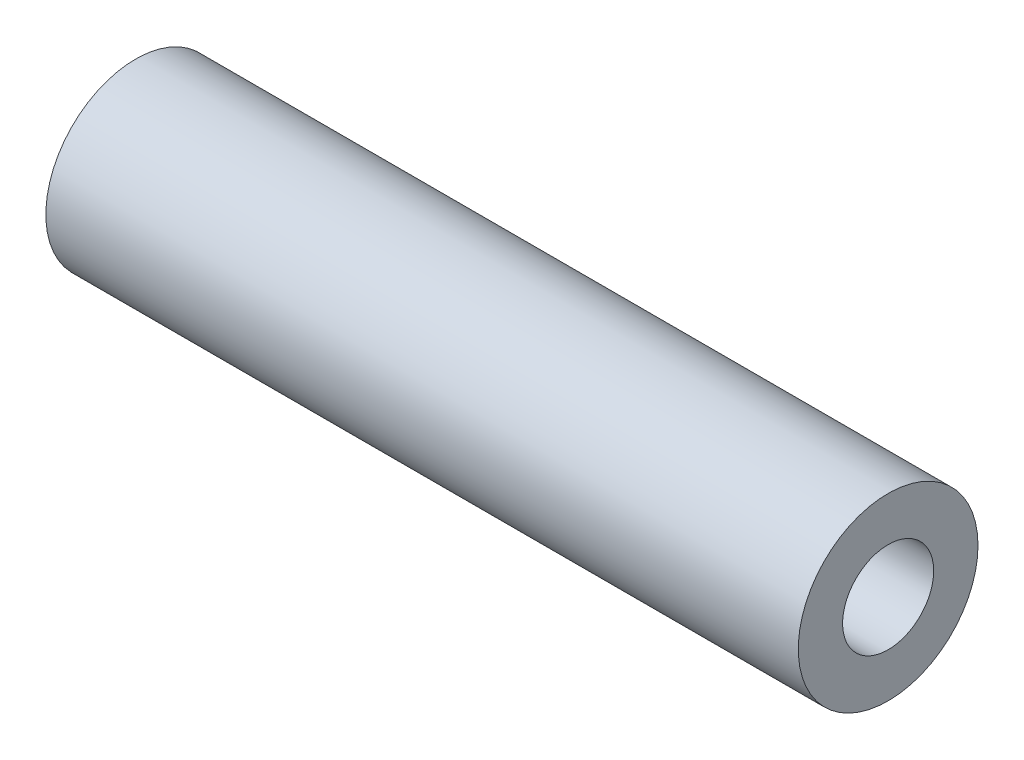
from build123d import *

# Parameters (mm, degrees)
SKETCH1_R           = 4.7625
SKETCH1_R_2         = 2.413
BOSS_EXTRUDE1_DEPTH = 19.939


with BuildPart() as part:
    # Sketch1 → Boss-Extrude1 (new, symmetric)
    with BuildSketch(Plane(origin=(0, 0, 0), x_dir=(0, 0, -1), z_dir=(1, 0, 0))):
        Circle(SKETCH1_R)
        Circle(SKETCH1_R_2, mode=Mode.SUBTRACT)
    extrude(amount=BOSS_EXTRUDE1_DEPTH, both=True)


solid = part.part
